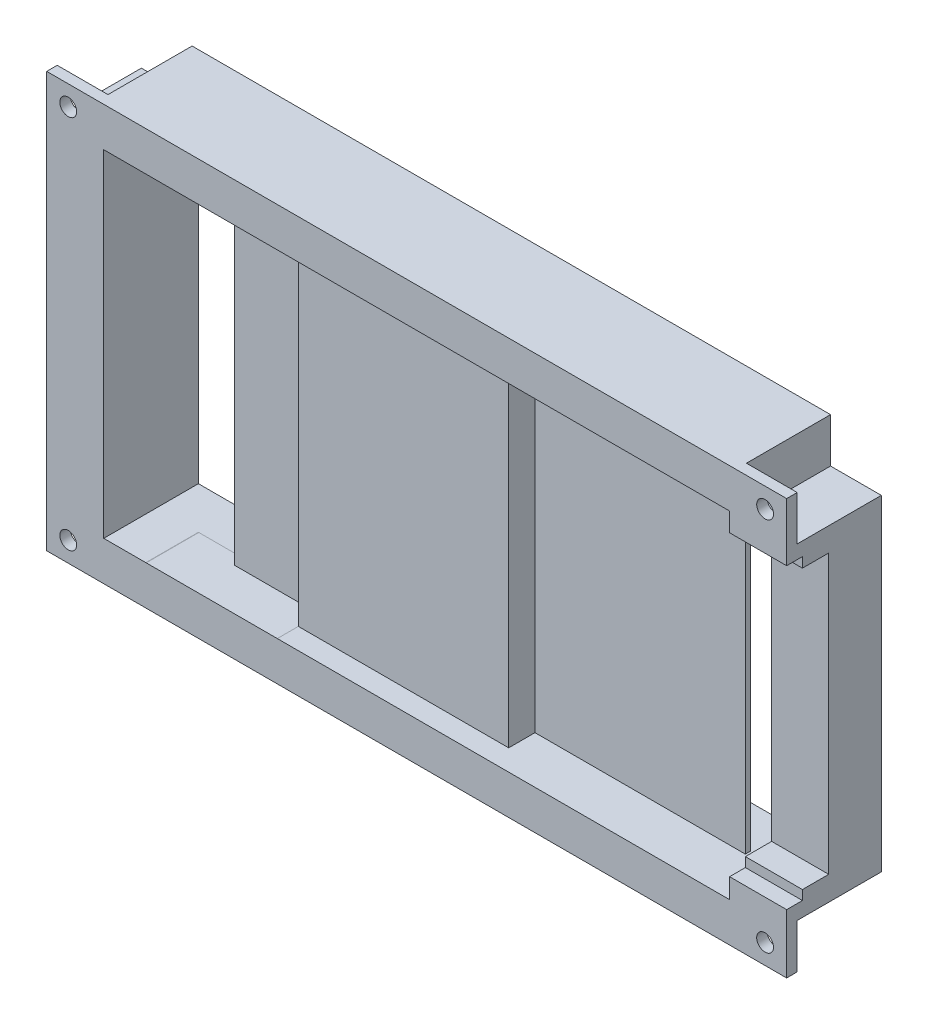
from build123d import *

# Parameters (mm, degrees)
EXTRUDE_1_DEPTH      = 10
EXTRUDE_1_DEPTH_BACK = 8
SKETCH_1_W           = 140.696839698
SKETCH_1_H           = 78.948263704
SKETCH_1_W_2         = 119
SKETCH_1_H_2         = 64
SKETCH_2_W           = 111
SKETCH_2_H           = 64
EXTRUDE_2_DEPTH      = 10
CUT_EXTRUDE_1_DEPTH  = 8
CUT_EXTRUDE_2_DEPTH  = 82.284114443
SKETCH_5_W           = 6
SKETCH_5_H           = 64
CUT_EXTRUDE_3_DEPTH  = 83.650512768
SKETCH_6_W           = 79.998419849
SKETCH_6_H           = 64
CUT_EXTRUDE_4_DEPTH  = 4
SKETCH_8_W           = 10.85
SKETCH_8_H           = 56.631058545
CUT_EXTRUDE_5_DEPTH  = 3
CUT_EXTRUDE_8_DEPTH  = 8
CUT_EXTRUDE_9_DEPTH  = 82.284114443
SKETCH_14_W          = 9.648040069
SKETCH_14_H          = 8.468800119
CUT_EXTRUDE_10_DEPTH = 16
SKETCH_15_R          = 1.6
CUT_EXTRUDE_11_DEPTH = 5
SKETCH_16_W          = 40
SKETCH_16_H          = 64
CUT_EXTRUDE_12_DEPTH = 5
SKETCH_17_W          = 10.85
SKETCH_17_H          = 52.918594423
CUT_EXTRUDE_13_DEPTH = 5
CUT_EXTRUDE_21_DEPTH = 10


with BuildPart() as part:
    # 草图1 → 凸台-拉伸1 (new, two sides: drawn at the far end of the back side and taken through both)
    with BuildSketch(Plane.XY.offset(-EXTRUDE_1_DEPTH_BACK)):
        Rectangle(SKETCH_1_W, SKETCH_1_H)
        Rectangle(SKETCH_1_W_2, SKETCH_1_H_2, mode=Mode.SUBTRACT)
    extrude(amount=EXTRUDE_1_DEPTH + EXTRUDE_1_DEPTH_BACK)

    # 草图2 → 凸台-拉伸2 (add)
    with BuildSketch(Plane.XY):
        with Locations((4, 0)):
            Rectangle(SKETCH_2_W, SKETCH_2_H)
    extrude(amount=EXTRUDE_2_DEPTH)

    # 草图3 → 切除-拉伸1 (cut)
    with BuildSketch(Plane.XY.offset(10)):
        Polygon((-51.5, 32), (-26.5, 32), (-26.5, -31.061558852), (-51.5, -32), align=None)
    extrude(amount=-CUT_EXTRUDE_1_DEPTH, mode=Mode.SUBTRACT)

    # 草图4 → 切除-拉伸2 (cut, through all)
    with BuildSketch(Plane.XY.offset(2)):
        Polygon((-51.5, 32), (-47.603613943, 32), (-47.603613943, -31.85373884), (-51.5, -32), align=None)
    extrude(amount=-CUT_EXTRUDE_2_DEPTH, mode=Mode.SUBTRACT)

    # 草图5 → 切除-拉伸3 (cut, through all)
    with BuildSketch(Plane.XY.offset(10)):
        with Locations((56.498419849, 0)):
            Rectangle(SKETCH_5_W, SKETCH_5_H)
    extrude(amount=-CUT_EXTRUDE_3_DEPTH, mode=Mode.SUBTRACT)

    # 草图6 → 切除-拉伸4 (cut)
    with BuildSketch(Plane.XY.offset(10)):
        with Locations((13.499209925, 0)):
            Rectangle(SKETCH_6_W, SKETCH_6_H)
    extrude(amount=-CUT_EXTRUDE_4_DEPTH, mode=Mode.SUBTRACT)

    # 草图8 → 切除-拉伸5 (cut)
    with BuildSketch(Plane.XY.offset(10)):
        with Locations((64.923419849, 0.100161726)):
            Rectangle(SKETCH_8_W, SKETCH_8_H)
    extrude(amount=-CUT_EXTRUDE_5_DEPTH, mode=Mode.SUBTRACT)

    # 草图11 → 切除-拉伸8 (cut)
    with BuildSketch(Plane.XY.offset(10)):
        Polygon((-26.5, -31.061558852), (-51.429548431, -31.997355414), (-26.5, -32), align=None)
    extrude(amount=-CUT_EXTRUDE_8_DEPTH, mode=Mode.SUBTRACT)

    # 草图12 → 切除-拉伸9 (cut, through all)
    with BuildSketch(Plane.XY.offset(2)):
        Polygon((-51.429548431, -31.997355414), (-47.603613943, -31.85373884), (-47.603613943, -31.997761278), align=None)
    extrude(amount=-CUT_EXTRUDE_9_DEPTH, mode=Mode.SUBTRACT)

    # 草图14 → 切除-拉伸10 (cut)
    with BuildSketch(Plane(origin=(0, 0, -8), x_dir=(-1, 0, 0), z_dir=(0, 0, -1))):
        with Locations((65.524399815, 35.239731793)):
            Rectangle(SKETCH_14_W, SKETCH_14_H)
        with Locations((65.524399815, -35.239731793)):
            Rectangle(SKETCH_14_W, SKETCH_14_H)
        with Locations((-65.524399815, -35.239731793)):
            Rectangle(SKETCH_14_W, SKETCH_14_H)
        with Locations((-65.524399815, 35.239731793)):
            Rectangle(SKETCH_14_W, SKETCH_14_H)
    extrude(amount=-CUT_EXTRUDE_10_DEPTH, mode=Mode.SUBTRACT)

    # 草图15 → 切除-拉伸11 (cut)
    with BuildSketch(Plane.XY.offset(10)):
        with Locations((66.252723787, 35.668268653)):
            Circle(SKETCH_15_R)
        with Locations((-66.252723787, 35.668268653)):
            Circle(SKETCH_15_R)
        with Locations((-66.252723787, -35.668268653)):
            Circle(SKETCH_15_R)
        with Locations((66.252723787, -35.668268653)):
            Circle(SKETCH_15_R)
    extrude(amount=-CUT_EXTRUDE_11_DEPTH, mode=Mode.SUBTRACT)

    # 草图16 → 切除-拉伸12 (cut)
    with BuildSketch(Plane.XY.offset(6)):
        with Locations((33.498419849, 0)):
            Rectangle(SKETCH_16_W, SKETCH_16_H)
    extrude(amount=-CUT_EXTRUDE_12_DEPTH, mode=Mode.SUBTRACT)

    # 草图17 → 切除-拉伸13 (cut)
    with BuildSketch(Plane.XY.offset(7)):
        with Locations((64.923419849, 0.054487669)):
            Rectangle(SKETCH_17_W, SKETCH_17_H)
    extrude(amount=-CUT_EXTRUDE_13_DEPTH, mode=Mode.SUBTRACT)

    # 草图19 → 切除-拉伸21 (cut)
    with BuildSketch(Plane.XY.offset(2)):
        Polygon((-47.603613943, 32), (-42.603613971, 32), (-42.603613971, -31.99829169), (-47.603613943, -31.997761278), align=None)
    extrude(amount=-CUT_EXTRUDE_21_DEPTH, mode=Mode.SUBTRACT)


solid = part.part
